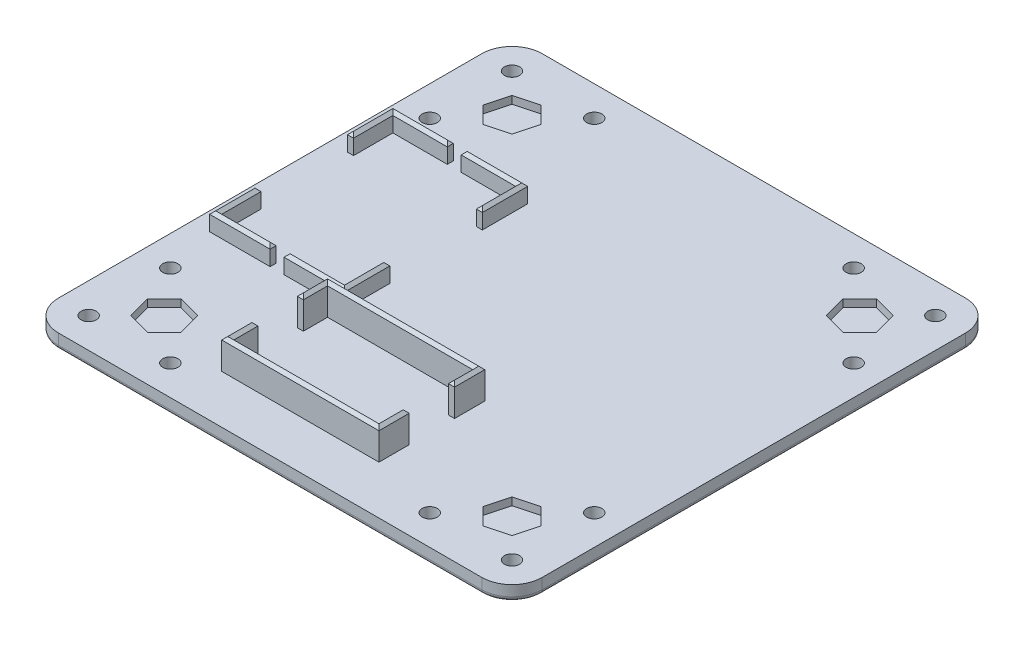
from build123d import *

# Parameters (mm, degrees)
SKETCH1_W           = 203.2
SKETCH1_H           = 203.2
BOSS_EXTRUDE1_DEPTH = 6.35
FILLET1_R           = 12.7
SKETCH2_R           = 3.175
CUT_EXTRUDE1_DEPTH  = 288.438345563
CUT_EXTRUDE2_DEPTH  = 3.175
BOSS_EXTRUDE2_DEPTH = 7.62
CHAMFER1_SIZE       = 1.27
BOSS_EXTRUDE3_DEPTH = 12.7
CHAMFER2_SIZE       = 1.27
FILLET2_R           = 1.905
SKETCH28_R          = 3.175
CUT_EXTRUDE3_DEPTH  = 288.648692054


with BuildPart() as part:
    # Sketch1 → Boss-Extrude1 (new body)
    with BuildSketch(Plane(origin=(0, 0, 0), x_dir=(1, 0, 0), z_dir=(0, 1, 0))):
        with Locations((101.6, 101.6)):
            Rectangle(SKETCH1_W, SKETCH1_H)
    extrude(amount=BOSS_EXTRUDE1_DEPTH)

    # Fillet1
    fillet1_edges = [part.edges().sort_by_distance(p)[0] for p in [
        (0, 3.175, -203.2),
        (203.2, 3.175, -203.2),
        (203.2, 3.175, 0),
        (0, 3.175, 0),
    ]]
    fillet(fillet1_edges, radius=FILLET1_R)

    # Sketch2 → Cut-Extrude1 (cut, through all)
    with BuildSketch(Plane.XZ):
        with Locations(Location((12.7, -12.7, 0), (0, 0, 270))):
            Circle(SKETCH2_R)
        with Locations(Location((190.5, -12.7, 0), (0, 0, 270))):
            Circle(SKETCH2_R)
        with Locations(Location((190.5, -190.5, 0), (0, 0, 270))):
            Circle(SKETCH2_R)
        with Locations(Location((12.7, -190.5, 0), (0, 0, 270))):
            Circle(SKETCH2_R)
    extrude(amount=-CUT_EXTRUDE1_DEPTH, mode=Mode.SUBTRACT)

    # Sketch22 → Cut-Extrude2 (cut)
    with BuildSketch(Plane(origin=(0, 6.35, 0), x_dir=(1, 0, 0), z_dir=(0, 1, 0))):
        Polygon((181.654219065, 181.654219065), (172.052127253, 184.227091812), (165.022908188, 177.197872747), (167.595780935, 167.595780935), (177.197872747, 165.022908188), (184.227091812, 172.052127253), align=None)
        Polygon((18.972908188, 172.052127253), (21.545780935, 181.654219065), (31.147872747, 184.227091812), (38.177091812, 177.197872747), (35.604219065, 167.595780935), (26.002127253, 165.022908188), align=None)
        Polygon((184.227091812, 31.147872747), (181.654219065, 21.545780935), (172.052127253, 18.972908188), (165.022908188, 26.002127253), (167.595780935, 35.604219065), (177.197872747, 38.177091812), align=None)
        Polygon((21.545780935, 21.545780935), (31.147872747, 18.972908188), (38.177091812, 26.002127253), (35.604219065, 35.604219065), (26.002127253, 38.177091812), (18.972908188, 31.147872747), align=None)
    extrude(amount=-CUT_EXTRUDE2_DEPTH, mode=Mode.SUBTRACT)

    # Sketch23 → Boss-Extrude2 (add)
    with BuildSketch(Plane(origin=(0, 6.35, 0), x_dir=(1, 0, 0), z_dir=(0, 1, 0))):
        Polygon((64.262, 145.542), (38.862, 145.542), (38.862, 143.002), (61.722, 143.002), (61.722, 126.492), (64.262, 126.492), align=None)
        Polygon((64.262, 68.58), (38.862, 68.58), (38.862, 71.12), (61.722, 71.12), (61.722, 87.63), (64.262, 87.63), align=None)
        Polygon((7.62, 145.542), (7.62, 126.492), (10.16, 126.492), (10.16, 143.002), (33.02, 143.002), (33.02, 145.542), align=None)
        Polygon((10.16, 87.63), (7.62, 87.63), (7.62, 68.58), (33.02, 68.58), (33.02, 71.12), (10.16, 71.12), align=None)
    extrude(amount=BOSS_EXTRUDE2_DEPTH)

    # Chamfer1
    chamfer1_edges = [part.edges().sort_by_distance(p)[0] for p in [
        (64.262, 13.97, -136.017),
        (51.562, 13.97, -145.542),
        (38.862, 13.97, -144.272),
        (50.292, 13.97, -143.002),
        (61.722, 13.97, -134.747),
        (62.992, 13.97, -126.492),
        (7.62, 13.97, -78.105),
        (20.32, 13.97, -68.58),
        (33.02, 13.97, -69.85),
        (21.59, 13.97, -71.12),
        (10.16, 13.97, -79.375),
        (8.89, 13.97, -87.63),
        (64.262, 13.97, -78.105),
        (62.992, 13.97, -87.63),
        (61.722, 13.97, -79.375),
        (50.292, 13.97, -71.12),
        (38.862, 13.97, -69.85),
        (51.562, 13.97, -68.58),
        (20.32, 13.97, -145.542),
        (7.62, 13.97, -136.017),
        (8.89, 13.97, -126.492),
        (10.16, 13.97, -134.747),
        (21.59, 13.97, -143.002),
        (33.02, 13.97, -144.272),
    ]]
    chamfer(chamfer1_edges, length=CHAMFER1_SIZE - 0.0001)  # a hair under: the kernel refuses the full size

    # Sketch24 → Boss-Extrude3 (add)
    with BuildSketch(Plane(origin=(0, 6.35, 0), x_dir=(1, 0, 0), z_dir=(0, 1, 0))):
        Polygon((124.46, 62.23), (63.5, 62.23), (63.5, 52.07), (60.96, 52.07), (60.96, 64.77), (127, 64.77), (127, 52.07), (124.46, 52.07), align=None)
        Polygon((124.46, 22.86), (63.5, 22.86), (63.5, 33.02), (60.96, 33.02), (60.96, 20.32), (127, 20.32), (127, 33.02), (124.46, 33.02), align=None)
    extrude(amount=BOSS_EXTRUDE3_DEPTH)

    # Chamfer2
    chamfer2_edges = [part.edges().sort_by_distance(p)[0] for p in [
        (124.46, 19.05, -57.15),
        (125.73, 19.05, -52.07),
        (127, 19.05, -58.42),
        (93.98, 19.05, -64.77),
        (60.96, 19.05, -58.42),
        (62.23, 19.05, -52.07),
        (63.5, 19.05, -57.15),
        (93.98, 19.05, -62.23),
        (63.5, 19.05, -27.94),
        (62.23, 19.05, -33.02),
        (60.96, 19.05, -26.67),
        (93.98, 19.05, -20.32),
        (127, 19.05, -26.67),
        (125.73, 19.05, -33.02),
        (124.46, 19.05, -27.94),
        (93.98, 19.05, -22.86),
    ]]
    chamfer(chamfer2_edges, length=CHAMFER2_SIZE - 0.0001)  # a hair under: the kernel refuses the full size

    # Fillet2
    fillet2_edges = [part.edges().sort_by_distance(p)[0] for p in [
        (0, 0, -101.6),
        (101.6, 0, -203.2),
        (203.2, 0, -101.6),
        (101.6, 0, 0),
        (199.480256121, 0, -199.480256121),
        (199.480256121, 0, -3.719743879),
        (3.719743879, 0, -3.719743879),
        (3.719743879, 0, -199.480256121),
        (12.7, 0, -187.325),
        (190.5, 0, -187.325),
        (190.5, 0, -9.525),
        (12.7, 0, -9.525),
    ]]
    fillet(fillet2_edges, radius=FILLET2_R)

    # Sketch28 → Cut-Extrude3 (cut, through all)
    with BuildSketch(Plane(origin=(0, 6.35, 0), x_dir=(1, 0, 0), z_dir=(0, 1, 0))):
        with Locations(Location((47.117, 190.627, 0), (0, 0, 270))):
            Circle(SKETCH28_R)
        with Locations(Location((156.083, 190.627, 0), (0, 0, 270))):
            Circle(SKETCH28_R)
        with Locations(Location((190.627, 156.083, 0), (0, 0, 270))):
            Circle(SKETCH28_R)
        with Locations(Location((190.627, 47.117, 0), (0, 0, 270))):
            Circle(SKETCH28_R)
        with Locations(Location((156.083, 12.573, 0), (0, 0, 270))):
            Circle(SKETCH28_R)
        with Locations(Location((47.117, 12.573, 0), (0, 0, 270))):
            Circle(SKETCH28_R)
        with Locations(Location((12.573, 156.083, 0), (0, 0, 270))):
            Circle(SKETCH28_R)
        with Locations(Location((12.573, 47.117, 0), (0, 0, 270))):
            Circle(SKETCH28_R)
    extrude(amount=-CUT_EXTRUDE3_DEPTH, mode=Mode.SUBTRACT)


solid = part.part
